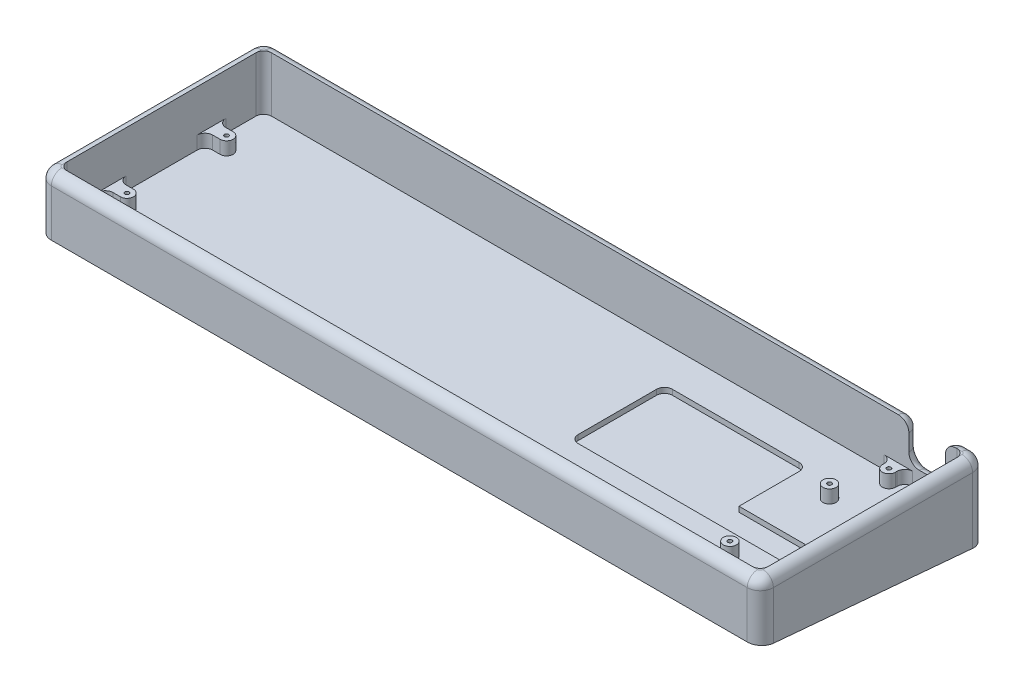
from build123d import *

# Parameters (mm, degrees)
BOSS_EXTRUDE1_DEPTH       = 276.125
SKETCH3_W                 = 268.125
SKETCH3_H                 = 78.2
CUT_EXTRUDE1_DEPTH        = 21
SKETCH4_W                 = 14
SKETCH4_H                 = 14.4
CUT_EXTRUDE2_DEPTH        = 4
FILLET1_R                 = 5
FILLET4_R                 = 3
FILLET5_R                 = 4
FILLET6_R                 = 4
SKETCH5_R                 = 2.5
BOSS_EXTRUDE2_DEPTH       = 5
FILLET7_R                 = 3
M2X0_4_TAPPED_HOLE4_D     = 1.6
M2X0_4_TAPPED_HOLE4_DEPTH = 3.719311505
M2X0_4_TAPPED_HOLE4_TIP   = 0.480688495
CUT_EXTRUDE3_DEPTH        = 2
FILLET8_R                 = 3
SKETCH10_R                = 5
CUT_EXTRUDE4_DEPTH        = 0.5


with BuildPart() as part:
    # Sketch1 → Boss-Extrude1 (new body)
    with BuildSketch(Plane(origin=(0, 0, 0), x_dir=(0, 0, -1), z_dir=(1, 0, 0))):
        Polygon((43.1, -11), (43.1, -18.54), (-43.1, -11), (-43.1, 11), (43.1, 11), align=None)
    extrude(amount=BOSS_EXTRUDE1_DEPTH)

    # Sketch3 → Cut-Extrude1 (cut)
    with BuildSketch(Plane(origin=(0, 11, 0), x_dir=(1, 0, 0), z_dir=(0, 1, 0))):
        with Locations((138.0625, 0)):
            Rectangle(SKETCH3_W, SKETCH3_H)
    extrude(amount=-CUT_EXTRUDE1_DEPTH, mode=Mode.SUBTRACT)

    # Sketch4 → Cut-Extrude2 (cut)
    with BuildSketch(Plane.XY.offset(-39.1)):
        with Locations((257.755, 3.8)):
            Rectangle(SKETCH4_W, SKETCH4_H)
    extrude(amount=-CUT_EXTRUDE2_DEPTH, mode=Mode.SUBTRACT)

    # Fillet1
    fillet1_edges = [part.edges().sort_by_distance(p)[0] for p in [
        (276.125, -3.77, -43.1),
        (276.125, 0, 43.1),
        (0, -3.77, -43.1),
        (0, 0, 43.1),
    ]]
    fillet(fillet1_edges, radius=FILLET1_R)

    # Fillet4
    fillet4_edges = [part.edges().sort_by_distance(p)[0] for p in [
        (272.125, 0.5, -39.1),
        (272.125, 0.5, 39.1),
        (4, 0.5, 39.1),
        (4, 0.5, -39.1),
    ]]
    fillet(fillet4_edges, radius=FILLET4_R)

    # Fillet5
    fillet5_edges = [part.edges().sort_by_distance(p)[0] for p in [
        (264.755, 11, -41.1),
        (264.755, -3.4, -41.1),
        (250.755, -3.4, -41.1),
        (250.755, 11, -41.1),
    ]]
    fillet(fillet5_edges, radius=FILLET5_R)

    # Fillet6
    fillet6_edges = [part.edges().sort_by_distance(p)[0] for p in [
        (274.660533906, 11, 41.635533906),
        (276.125, 11, 0),
        (274.660533906, 11, -41.635533906),
        (269.94, 11, -43.1),
        (265.926572875, 9.828427125, -43.1),
        (264.755, 3.8, -43.1),
        (263.583427125, -2.228427125, -43.1),
        (257.755, -3.4, -43.1),
        (251.926572875, -2.228427125, -43.1),
        (250.755, 3.8, -43.1),
        (249.583427125, 9.828427125, -43.1),
        (125.8775, 11, -43.1),
        (1.464466094, 11, -41.635533906),
        (0, 11, 0),
        (1.464466094, 11, 41.635533906),
        (138.0625, 11, 43.1),
    ]]
    fillet(fillet6_edges, radius=FILLET6_R - 0.0001)  # a hair under: the kernel refuses the full size

    # Sketch5 → Boss-Extrude2 (add)
    with BuildSketch(Plane(origin=(0, -10, 0), x_dir=(1, 0, 0), z_dir=(0, 1, 0))):
        with Locations(Location((240.4, 19.1, 0), (0, 0, 90))):
            Circle(SKETCH5_R)
        with Locations(Location((240.4, -19, 0), (0, 0, 90))):
            Circle(SKETCH5_R)
        with BuildLine():
            Line((9.8, 21.6), (4, 21.6))
            Line((4, 21.6), (4, 16.6))
            Line((4, 16.6), (9.8, 16.6))
            ThreePointArc((9.8, 16.6), (12.3, 19.1), (9.8, 21.6))
        make_face()
        with BuildLine():
            Line((9.8, -16.5), (4, -16.5))
            Line((4, -16.5), (4, -21.5))
            Line((4, -21.5), (9.8, -21.5))
            ThreePointArc((9.8, -21.5), (12.3, -19), (9.8, -16.5))
        make_face()
        with BuildLine():
            Line((244.225, 35.5), (244.225, 39.1))
            Line((244.225, 39.1), (249.225, 39.1))
            Line((249.225, 39.1), (249.225, 35.5))
            ThreePointArc((249.225, 35.5), (246.725, 33), (244.225, 35.5))
        make_face()
        with BuildLine():
            Line((265.995, 35.5), (265.995, 39.1))
            Line((265.995, 39.1), (269.125, 39.1))
            ThreePointArc((269.125, 39.1), (271.246320344, 38.221320344), (272.125, 36.1))
            Line((272.125, 36.1), (272.125, 33))
            Line((272.125, 33), (268.495, 33))
            ThreePointArc((268.495, 33), (266.727233047, 33.732233047), (265.995, 35.5))
        make_face()
        with BuildLine():
            Line((249.225, -35.5), (249.225, -39.1))
            Line((249.225, -39.1), (244.225, -39.1))
            Line((244.225, -39.1), (244.225, -35.5))
            ThreePointArc((244.225, -35.5), (246.725, -33), (249.225, -35.5))
        make_face()
        with BuildLine():
            Line((268.495, -33), (272.125, -33))
            Line((272.125, -33), (272.125, -36.1))
            ThreePointArc((272.125, -36.1), (271.246320344, -38.221320344), (269.125, -39.1))
            Line((269.125, -39.1), (265.995, -39.1))
            Line((265.995, -39.1), (265.995, -35.5))
            ThreePointArc((265.995, -35.5), (266.727233047, -33.732233047), (268.495, -33))
        make_face()
    extrude(amount=BOSS_EXTRUDE2_DEPTH)

    # Fillet7
    fillet7_edges = [part.edges().sort_by_distance(p)[0] for p in [
        (4, -7.5, 16.5),
        (4, -7.5, 21.5),
        (244.225, -7.5, 39.1),
        (249.225, -7.5, 39.1),
        (265.995, -7.5, 39.1),
        (272.125, -7.5, 33),
        (249.225, -7.5, -39.1),
        (244.225, -7.5, -39.1),
        (4, -7.5, -21.6),
        (4, -7.5, -16.6),
        (272.125, -7.5, -33),
        (265.995, -7.5, -39.1),
    ]]
    fillet(fillet7_edges, radius=FILLET7_R)

    # M2x0.4 Tapped Hole4
    with Locations(Plane(origin=(0, -5, 0), x_dir=(1, 0, 0), z_dir=(0, 1, 0))):
        with Locations((9.8, 19.1), (9.8, -19), (240.4, 19.1), (240.4, -19), (246.725, 35.5), (268.495, 35.5), (268.495, -35.5), (246.725, -35.5)):
            Hole(M2X0_4_TAPPED_HOLE4_D / 2, depth=M2X0_4_TAPPED_HOLE4_DEPTH)
            with Locations((0, 0, -(M2X0_4_TAPPED_HOLE4_DEPTH + M2X0_4_TAPPED_HOLE4_TIP / 2))):  # 118° drill point
                Cone(0, M2X0_4_TAPPED_HOLE4_D / 2, M2X0_4_TAPPED_HOLE4_TIP, mode=Mode.SUBTRACT)

    # Sketch9 → Cut-Extrude3 (cut)
    with BuildSketch(Plane(origin=(0, -10, 0), x_dir=(1, 0, 0), z_dir=(0, 1, 0))):
        Polygon((243.575047285, -10.7), (253.575047285, -10.7), (253.575047285, -0.7), (243.575047285, -0.7), (225.575047285, -0.7), (225.575047285, 25.3), (171.075047285, 25.3), (171.075047285, -10.7), align=None)
    extrude(amount=-CUT_EXTRUDE3_DEPTH, mode=Mode.SUBTRACT)

    # Fillet8
    fillet8_edges = [part.edges().sort_by_distance(p)[0] for p in [
        (253.575047285, -11, 0.7),
        (253.575047285, -11, 10.7),
        (171.075047285, -11, 10.7),
        (171.075047285, -11, -25.3),
        (225.575047285, -11, -25.3),
    ]]
    fillet(fillet8_edges, radius=FILLET8_R)

    # Sketch10 → Cut-Extrude4 (cut)
    with BuildSketch(Plane(origin=(0, -14.657850216, 1.282136782), x_dir=(1, 0, 0), z_dir=(0, -0.9961962259253339, 0.08713827776655463))):
        with Locations(Location((266.125, -34.551601007, 0), (0, 0, 270))):
            Circle(SKETCH10_R)
        with Locations(Location((266.125, 31.977536282, 0), (0, 0, 270))):
            Circle(SKETCH10_R)
        with Locations(Location((10, 31.977536282, 0), (0, 0, 270))):
            Circle(SKETCH10_R)
        with Locations(Location((10, -34.551601007, 0), (0, 0, 270))):
            Circle(SKETCH10_R)
    extrude(amount=-CUT_EXTRUDE4_DEPTH, mode=Mode.SUBTRACT)


solid = part.part
